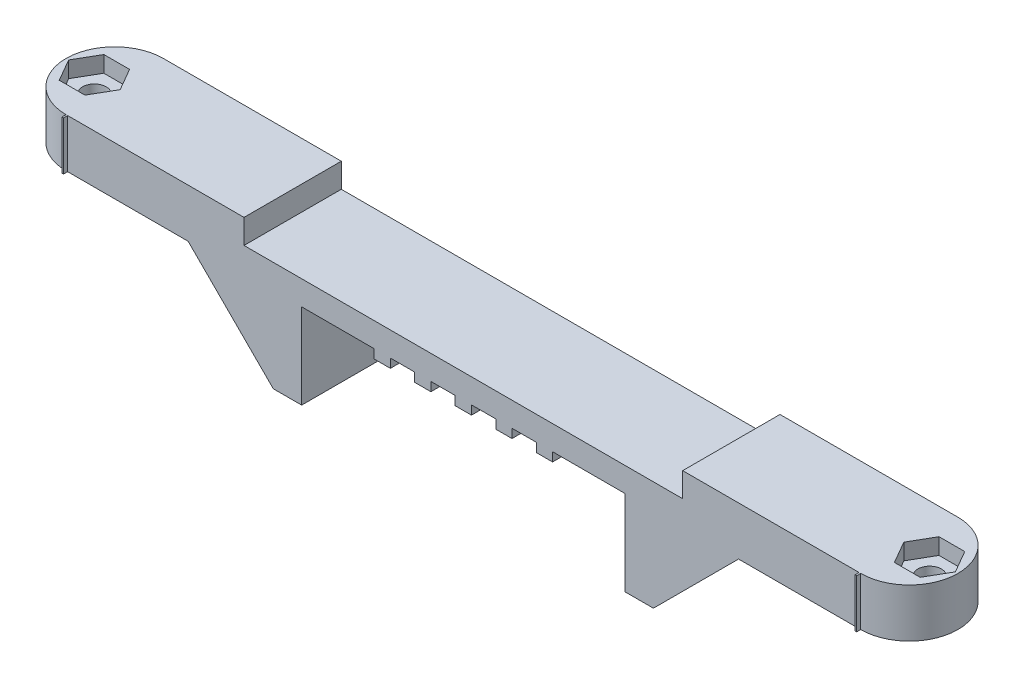
from build123d import *

# Parameters (mm, degrees)
SKETCH1_R                 = 1.45
BOSS_EXTRUDE1_DEPTH       = 3
SKETCH4_W                 = 3.5
SKETCH4_H                 = 12
BOSS_EXTRUDE3_DEPTH       = 10.5
SKETCH5_W                 = 2
SKETCH5_H                 = 12
BOSS_EXTRUDE4_DEPTH       = 1.1
SKETCH6_W                 = 0.2
SKETCH6_H                 = 3
BOSS_EXTRUDE5_DEPTH       = 0.5
CHAMFER1_SIZE             = 10.5
F_3_0MM_DOWEL_HOLE1_D     = 2.9
F_3_0MM_DOWEL_HOLE1_DEPTH = 13.5
SKETCH10_R                = 1.45
BOSS_EXTRUDE6_DEPTH       = 3
CUT_EXTRUDE1_START        = -2
SKETCH11_R                = 1.45
CUT_EXTRUDE1_DEPTH        = 2


with BuildPart() as part:
    # Sketch1 → Boss-Extrude1 (new body)
    with BuildSketch(Plane(origin=(0, 0, 0), x_dir=(1, 0, 0), z_dir=(0, 1, 0))):
        with BuildLine():
            Line((-49, 6), (49, 6))
            ThreePointArc((49, 6), (55, 0), (49, -6))
            Line((49, -6), (-49, -6))
            ThreePointArc((-49, -6), (-55, 0), (-49, 6))
        make_face()
        with Locations(Location((-51.5, 0, 0), (0, 0, 270))):
            Circle(SKETCH1_R, mode=Mode.SUBTRACT)
        with Locations(Location((51.5, 0, 0), (0, 0, 270))):
            Circle(SKETCH1_R, mode=Mode.SUBTRACT)
    extrude(amount=BOSS_EXTRUDE1_DEPTH)

    # Sketch4 → Boss-Extrude3 (add)
    with BuildSketch(Plane.XZ):
        with Locations((-21.690023983, 0)):
            Rectangle(SKETCH4_W, SKETCH4_H)
        with Locations((21.690023983, 0)):
            Rectangle(SKETCH4_W, SKETCH4_H)
    extrude(amount=BOSS_EXTRUDE3_DEPTH)

    # Sketch5 → Boss-Extrude4 (add)
    with BuildSketch(Plane.XZ):
        with Locations((5, 0)):
            Rectangle(SKETCH5_W, SKETCH5_H)
        Rectangle(SKETCH5_W, SKETCH5_H)
        with Locations((10, 0)):
            Rectangle(SKETCH5_W, SKETCH5_H)
        with Locations((-5, 0)):
            Rectangle(SKETCH5_W, SKETCH5_H)
        with Locations((-10, 0)):
            Rectangle(SKETCH5_W, SKETCH5_H)
    extrude(amount=BOSS_EXTRUDE4_DEPTH)

    # Sketch6 → Boss-Extrude5 (add)
    with BuildSketch(Plane.XY.offset(6)):
        with Locations((48.9, 1.5)):
            Rectangle(SKETCH6_W, SKETCH6_H)
        with Locations((-48.9, 1.5)):
            Rectangle(SKETCH6_W, SKETCH6_H)
    extrude(amount=BOSS_EXTRUDE5_DEPTH)

    # Chamfer1
    chamfer1_edges = [part.edges().sort_by_distance(p)[0] for p in [
        (23.440023983, 0, 0),
        (-23.440023983, 0, 0),
    ]]
    chamfer(chamfer1_edges, length=CHAMFER1_SIZE - 0.0001)  # a hair under: the kernel refuses the full size

    # Ø3.0mm Dowel Hole1
    with Locations(Plane(origin=(0, 3, 0), x_dir=(1, 0, 0), z_dir=(0, 1, 0))):
        with Locations((-51.5, 0), (51.5, 0)):
            Hole(F_3_0MM_DOWEL_HOLE1_D / 2, depth=F_3_0MM_DOWEL_HOLE1_DEPTH)

    # Sketch10 → Boss-Extrude6 (add)
    # profile 1 of 2: a face of its own
    with BuildSketch(Plane(origin=(0, 3, 0), x_dir=(1, 0, 0), z_dir=(0, 1, 0))):
        with BuildLine():
            Line((-48.8, -6), (-27.05, -6))
            Line((-27.05, -6), (-27.05, 6))
            Line((-27.05, 6), (-49, 6))
            ThreePointArc((-49, 6), (-55, 0), (-49, -6))
            Line((-49, -6), (-49, -6.5))
            Line((-49, -6.5), (-48.8, -6.5))
            Line((-48.8, -6.5), (-48.8, -6))
        make_face()
        with Locations(Location((-51.5, 0, 0), (0, 0, 270.000000001))):
            Circle(SKETCH10_R, mode=Mode.SUBTRACT)
    # profile 2 of 2: a face of its own
    with BuildSketch(Plane(origin=(0, 3, 0), x_dir=(1, 0, 0), z_dir=(0, 1, 0))):
        with BuildLine():
            Line((27.05, 6), (27.05, -6))
            Line((27.05, -6), (48.8, -6))
            Line((48.8, -6), (48.8, -6.5))
            Line((48.8, -6.5), (49, -6.5))
            Line((49, -6.5), (49, -6))
            ThreePointArc((49, -6), (55, 0), (49, 6))
            Line((49, 6), (27.05, 6))
        make_face()
        with Locations(Location((51.5, 0, 0), (0, 0, 270))):
            Circle(SKETCH10_R, mode=Mode.SUBTRACT)
    extrude(amount=BOSS_EXTRUDE6_DEPTH)

    # Sketch11 → Cut-Extrude1 (cut)
    # profile 1 of 2: a face of its own
    with BuildSketch(Plane(origin=(0, 6, 0), x_dir=(1, 0, 0), z_dir=(0, 1, 0)).offset(CUT_EXTRUDE1_START)):
        Polygon((53.08771324, 2.75), (54.675426481, 0), (53.08771324, -2.75), (49.91228676, -2.75), (48.324573519, 0), (49.91228676, 2.75), align=None)
    # profile 2 of 2: a face of its own
    with BuildSketch(Plane(origin=(0, 6, 0), x_dir=(1, 0, 0), z_dir=(0, 1, 0)).offset(CUT_EXTRUDE1_START)):
        Polygon((-48.324573519, 0), (-49.91228676, 2.75), (-53.08771324, 2.75), (-54.675426481, 0), (-53.08771324, -2.75), (-49.91228676, -2.75), align=None)
        with Locations(Location((-51.5, 0, 0), (0, 0, 270.000000001))):
            Circle(SKETCH11_R, mode=Mode.SUBTRACT)
    extrude(amount=CUT_EXTRUDE1_DEPTH, mode=Mode.SUBTRACT)


solid = part.part
